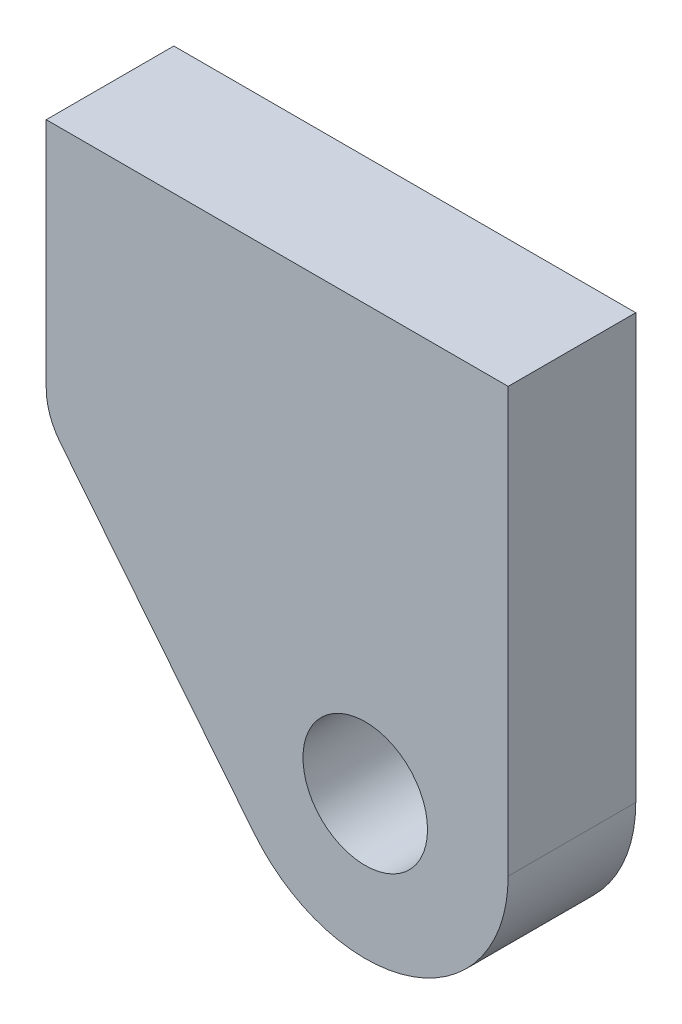
from build123d import *

# Parameters (mm, degrees)
SKETCH1_R           = 1.5494
BOSS_EXTRUDE1_DEPTH = 1.5875


with BuildPart() as part:
    # Sketch1 → Boss-Extrude1 (new, symmetric)
    with BuildSketch(Plane.XY):
        with BuildLine():
            Line((5.74675, 0), (-5.74675, 0))
            Line((-5.74675, 0), (-5.74675, -5.791392014))
            ThreePointArc((-5.74675, -5.791392014), (-5.65674567, -6.318329362), (-5.396938386, -6.785516609))
            Line((-5.396938386, -6.785516609), (-0.581671984, -12.780539093))
            ThreePointArc((-0.581671984, -12.780539093), (3.37108966, -13.9080903), (5.74675, -10.5537))
            Line((5.74675, -10.5537), (5.74675, 0))
        make_face()
        with Locations((2.19075, -10.5537)):
            Circle(SKETCH1_R, mode=Mode.SUBTRACT)
    extrude(amount=BOSS_EXTRUDE1_DEPTH, both=True)


solid = part.part
